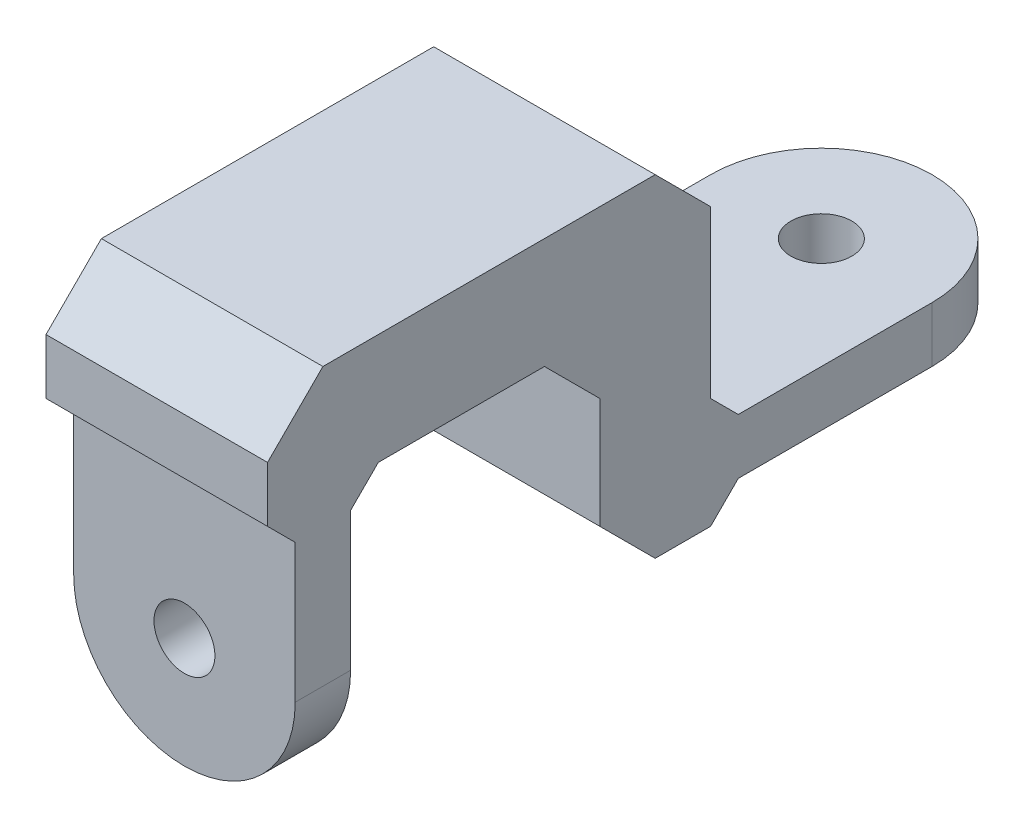
from build123d import *

# Parameters (mm, degrees)
SKETCH1_W               = 20
SKETCH1_H               = 10
BOSS_EXTRUDE1_DEPTH     = 10
SKETCH3_W               = 20
SKETCH3_H               = 5
BOSS_EXTRUDE2_DEPTH     = 20
FILLET1_R               = 10
BOSS_EXTRUDE3_DEPTH     = 20
CUT_EXTRUDE1_DEPTH      = 56.733742024
CUT_EXTRUDE1_DEPTH_BACK = 56.733742024
SKETCH5_R               = 2.75
CHAMFER1_SIZE           = 10
SKETCH6_W               = 20
SKETCH6_H               = 5
BOSS_EXTRUDE4_DEPTH     = 20
FILLET2_R               = 10
CUT_EXTRUDE2_DEPTH      = 73.672209269
CUT_EXTRUDE2_DEPTH_BACK = 5
SKETCH7_R               = 2.75
CHAMFER2_SIZE           = 5
CHAMFER3_SIZE           = 5


# Some blends are built 0.0001 mm under size
with BuildPart() as part:
    # Sketch1 → Boss-Extrude1 (new body)
    with BuildSketch(Plane.XY):
        Rectangle(SKETCH1_W, SKETCH1_H)
    extrude(amount=BOSS_EXTRUDE1_DEPTH)

    # Sketch3 → Boss-Extrude2 (add)
    with BuildSketch(Plane(origin=(0, 0, 0), x_dir=(-1, 0, 0), z_dir=(0, 0, -1))):
        Rectangle(SKETCH3_W, SKETCH3_H)
    extrude(amount=BOSS_EXTRUDE2_DEPTH)

    # Fillet1
    fillet1_edges = [part.edges().sort_by_distance(p)[0] for p in [
        (-10, 0, -20),
        (10, 0, -20),
    ]]
    fillet(fillet1_edges, radius=FILLET1_R - 0.0001)  # a hair under: the kernel refuses the full size

    # Sketch4 → Boss-Extrude3 (add)
    with BuildSketch(Plane.ZY.offset(10)):
        Polygon((20, -5), (20, 15), (40, 15), (40, 10), (50, 10), (50, 25), (10, 25), (10, -5), align=None)
    extrude(amount=-BOSS_EXTRUDE3_DEPTH)

    # Sketch5 → Cut-Extrude1 (cut, two sides: drawn at the far end of the back side and taken through both)
    with BuildSketch(Plane(origin=(0, 2.5, 0), x_dir=(1, 0, 0), z_dir=(0, 1, 0)).offset(-CUT_EXTRUDE1_DEPTH_BACK)):
        with Locations(Location((0, 10, 0), (0, 0, 270))):
            Circle(SKETCH5_R)
    extrude(amount=CUT_EXTRUDE1_DEPTH + CUT_EXTRUDE1_DEPTH_BACK, mode=Mode.SUBTRACT)

    # Chamfer1
    # the kernel refuses this chamfer: 10 mm, written as the material it takes off along each edge
    with BuildSketch(Plane(origin=(35.71682988, 5, 0), x_dir=(0, -0.9996219169112968, -0.027495876610586372), z_dir=(-1, 0, 0))) as chamfer1_piece_1_section:
        Polygon((CHAMFER1_SIZE * 0.999621916911, CHAMFER1_SIZE * 0.0274958766106), (-CHAMFER1_SIZE * 0.0274958766106, CHAMFER1_SIZE * 0.999621916911), (0, 0), align=None)
    chamfer1_piece_1 = extrude(amount=71.433659759, mode=Mode.PRIVATE)
    chamfer1_piece_1 = split(chamfer1_piece_1, bisect_by=Plane(origin=(0, -2.5, 0.578931494), z_dir=(0, -1, 0)), keep=Keep.TOP, mode=Mode.PRIVATE)
    add(chamfer1_piece_1, mode=Mode.SUBTRACT)
    with BuildSketch(Plane(origin=(35.71682988, 5, 0), x_dir=(0, -0.9996219169112968, -0.027495876610586372), z_dir=(-1, 0, 0))) as chamfer1_piece_2_section:
        Polygon((CHAMFER1_SIZE * 0.999621916911, CHAMFER1_SIZE * 0.0274958766106), (-CHAMFER1_SIZE * 0.0274958766106, CHAMFER1_SIZE * 0.999621916911), (0, 0), align=None)
    chamfer1_piece_2 = extrude(amount=71.433659759, mode=Mode.PRIVATE)
    chamfer1_piece_2 = split(chamfer1_piece_2, bisect_by=Plane(origin=(0, 2.5, 4.466280687), z_dir=(0, 1, 0)), keep=Keep.TOP, mode=Mode.PRIVATE)
    chamfer1_piece_2 = split(chamfer1_piece_2, bisect_by=Plane(origin=(0, 3.939233337, 10), z_dir=(0, 0, -1)), keep=Keep.TOP, mode=Mode.PRIVATE)
    add(chamfer1_piece_2, mode=Mode.SUBTRACT)
    with BuildSketch(Plane(origin=(-35.71682988, -5, 0), x_dir=(0, -0.027495876610586403, 0.9996219169112968), z_dir=(1, 0, 0))) as chamfer1_piece_3_section:
        Polygon((CHAMFER1_SIZE * 0.999621916911, -CHAMFER1_SIZE * 0.0274958766106), (-CHAMFER1_SIZE * 0.0274958766106, -CHAMFER1_SIZE * 0.999621916911), (0, 0), align=None)
    chamfer1_piece_3 = extrude(amount=71.433659759, mode=Mode.PRIVATE)
    chamfer1_piece_3 = split(chamfer1_piece_3, bisect_by=Plane(origin=(0, -2.5, 4.487529346), z_dir=(0, -1, 0)), keep=Keep.TOP, mode=Mode.PRIVATE)
    add(chamfer1_piece_3, mode=Mode.SUBTRACT)
    with BuildSketch(Plane(origin=(-35.71682988, -5, 0), x_dir=(0, -0.027495876610586403, 0.9996219169112968), z_dir=(1, 0, 0))) as chamfer1_piece_4_section:
        Polygon((CHAMFER1_SIZE * 0.999621916911, -CHAMFER1_SIZE * 0.0274958766106), (-CHAMFER1_SIZE * 0.0274958766106, -CHAMFER1_SIZE * 0.999621916911), (0, 0), align=None)
    chamfer1_piece_4 = extrude(amount=71.433659759, mode=Mode.PRIVATE)
    chamfer1_piece_4 = split(chamfer1_piece_4, bisect_by=Plane(origin=(0, 2.5, 0.578931494), z_dir=(0, 1, 0)), keep=Keep.TOP, mode=Mode.PRIVATE)
    add(chamfer1_piece_4, mode=Mode.SUBTRACT)

    # Sketch6 → Boss-Extrude4 (add)
    with BuildSketch(Plane.XZ.offset(-10)):
        with Locations((0, 45)):
            Rectangle(SKETCH6_W, SKETCH6_H)
    extrude(amount=BOSS_EXTRUDE4_DEPTH)

    # Fillet2
    fillet2_edges = [part.edges().sort_by_distance(p)[0] for p in [
        (10, -10, 45),
        (-10, -10, 45),
    ]]
    fillet(fillet2_edges, radius=FILLET2_R - 0.0001)  # a hair under: the kernel refuses the full size

    # Sketch7 → Cut-Extrude2 (cut, two sides: drawn at the far end of the back side and taken through both)
    with BuildSketch(Plane.XY.offset(47.5).offset(-CUT_EXTRUDE2_DEPTH_BACK)):
        Circle(SKETCH7_R)
    extrude(amount=CUT_EXTRUDE2_DEPTH + CUT_EXTRUDE2_DEPTH_BACK, mode=Mode.SUBTRACT)

    # Chamfer2
    # the kernel refuses this chamfer: 5 mm, written as the material it takes off along each edge
    with BuildSketch(Plane(origin=(-22.85841494, 10, 40), x_dir=(0, -0.027495876610586317, 0.9996219169112968), z_dir=(1, 0, 0))) as chamfer2_piece_1_section:
        Polygon((CHAMFER2_SIZE * 0.999621916911, -CHAMFER2_SIZE * 0.0274958766106), (-CHAMFER2_SIZE * 0.0274958766106, -CHAMFER2_SIZE * 0.999621916911), (0, 0), align=None)
    chamfer2_piece_1 = extrude(amount=45.71682988, mode=Mode.PRIVATE)
    chamfer2_piece_1 = split(chamfer2_piece_1, bisect_by=Plane(origin=(0, 11.959930185, 42.5), z_dir=(0, 0, -1)), keep=Keep.TOP, mode=Mode.PRIVATE)
    chamfer2_piece_1 = split(chamfer2_piece_1, bisect_by=Plane(origin=(0, 15, 41.043890797), z_dir=(0, -1, 0)), keep=Keep.TOP, mode=Mode.PRIVATE)
    add(chamfer2_piece_1, mode=Mode.SUBTRACT)
    with BuildSketch(Plane(origin=(-22.85841494, 10, 50), x_dir=(0, -0.027495876610586317, -0.9996219169112968), z_dir=(1, 0, 0))) as chamfer2_piece_2_section:
        Polygon((CHAMFER2_SIZE * 0.999621916911, CHAMFER2_SIZE * 0.0274958766106), (-CHAMFER2_SIZE * 0.0274958766106, CHAMFER2_SIZE * 0.999621916911), (0, 0), align=None)
    chamfer2_piece_2 = extrude(amount=45.71682988, mode=Mode.PRIVATE)
    chamfer2_piece_2 = split(chamfer2_piece_2, bisect_by=Plane(origin=(0, 11.967005421, 47.5), z_dir=(0, 0, 1)), keep=Keep.TOP, mode=Mode.PRIVATE)
    add(chamfer2_piece_2, mode=Mode.SUBTRACT)

    # Chamfer3
    chamfer3_edges = [part.edges().sort_by_distance(p)[0] for p in [
        (0, 25, 10),
        (0, 25, 50),
        (0, 15, 20),
        (0, -5, 20),
    ]]
    chamfer(chamfer3_edges, length=CHAMFER3_SIZE)


solid = part.part
